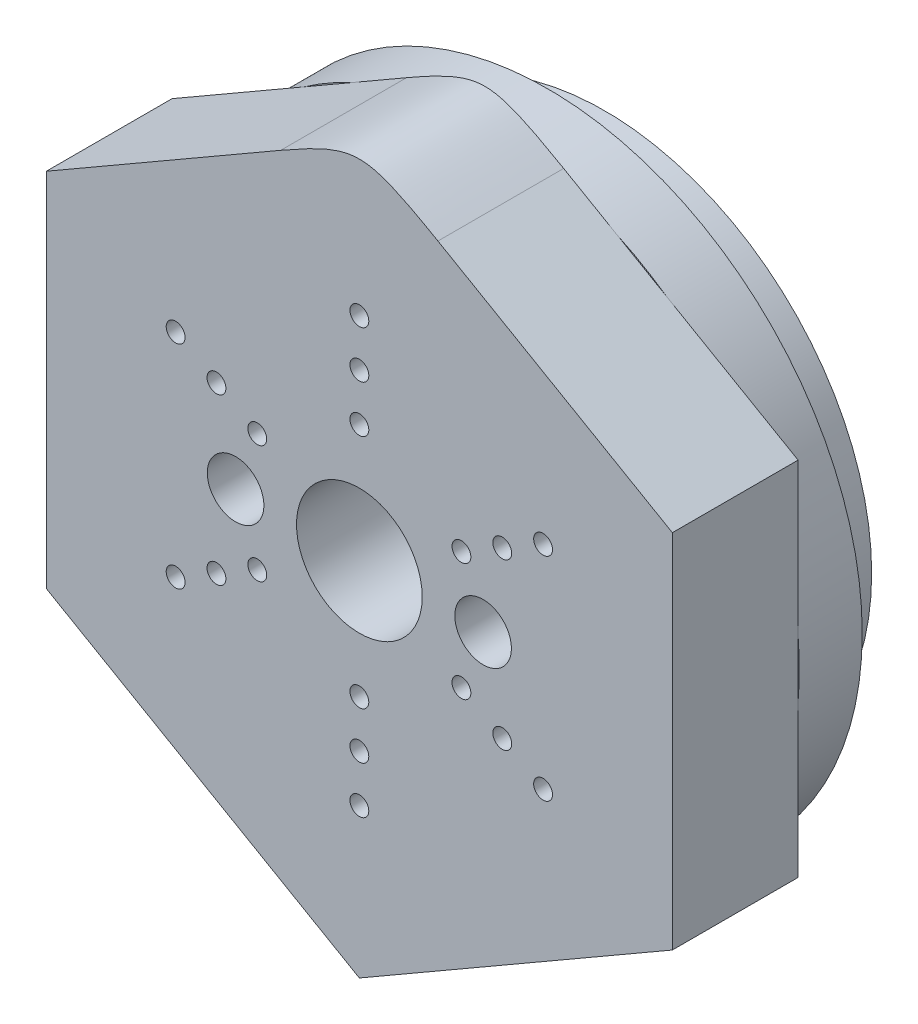
from build123d import *

# Parameters (mm, degrees)
SKETCH1_R               = 17
BOSS_EXTRUDE1_DEPTH     = 3.6
CAVITY1_OUTLINE_R       = 3.15
CAVITY1_DEPTH           = 3.283595969
CAVITY1_START           = 1.183595969
CAVITY1_2_OUTLINE_R     = 3.15
CAVITY1_2_OUTLINE_R_2   = 1.575
CAVITY1_2_DEPTH         = 2.1
SKETCH9_R               = 20
BOSS_EXTRUDE3_DEPTH     = 4
BOSS_EXTRUDE8_DEPTH     = 8
SKETCH2_R               = 0.6
CUT_EXTRUDE1_DEPTH      = 35.23974299
CIRPATTERN1_COUNT       = 6
SKETCH3_R               = 4.596048158
CUT_EXTRUDE2_DEPTH      = 3.283595969
CUT_EXTRUDE3_DEPTH      = 35.23974299
CUT_EXTRUDE3_DEPTH_BACK = 4
SKETCH4_R               = 4
SKETCH6_R               = 1.8
CUT_EXTRUDE4_DEPTH      = 35.23974299


with BuildPart() as part:
    # Sketch1 → Boss-Extrude1 (new body)
    with BuildSketch(Plane.XY):
        Circle(SKETCH1_R)
    extrude(amount=BOSS_EXTRUDE1_DEPTH)

    # Cavity1: read off the stored shape, not the designer's step
    # Cavity1 outline → Cavity1 (cut)
    with BuildSketch(Plane.XY):
        with BuildLine():
            Line((3.9375, 6.819950055), (2.048148228, 15.163776711))
            ThreePointArc((2.048148228, 15.163776711), (0, 16.8), (-2.048148228, 15.163776711))
            Line((-2.048148228, 15.163776711), (-3.9375, 6.819950055))
            Line((-3.9375, 6.819950055), (-12.108141735, 9.355636751))
            ThreePointArc((-12.108141735, 9.355636751), (-14.549226784, 8.4), (-14.156289963, 5.80813996))
            Line((-14.156289963, 5.80813996), (-7.875, 0))
            Line((-7.875, 0), (-14.156289963, -5.80813996))
            ThreePointArc((-14.156289963, -5.80813996), (-14.549226784, -8.4), (-12.108141735, -9.355636751))
            Line((-12.108141735, -9.355636751), (-3.9375, -6.819950055))
            Line((-3.9375, -6.819950055), (-2.048148228, -15.163776711))
            ThreePointArc((-2.048148228, -15.163776711), (0, -16.8), (2.048148228, -15.163776711))
            Line((2.048148228, -15.163776711), (3.9375, -6.819950055))
            Line((3.9375, -6.819950055), (12.108141735, -9.355636751))
            ThreePointArc((12.108141735, -9.355636751), (14.549226784, -8.4), (14.156289963, -5.80813996))
            Line((14.156289963, -5.80813996), (7.875, 0))
            Line((7.875, 0), (14.156289963, 5.80813996))
            ThreePointArc((14.156289963, 5.80813996), (14.549226784, 8.4), (12.108141735, 9.355636751))
            Line((12.108141735, 9.355636751), (3.9375, 6.819950055))
        make_face()
        Circle(CAVITY1_OUTLINE_R, mode=Mode.SUBTRACT)
    extrude(amount=CAVITY1_DEPTH, mode=Mode.SUBTRACT)

    # Cavity1 2 outline → Cavity1 2 (cut)
    with BuildSketch(Plane.XY.offset(CAVITY1_START)):
        Circle(CAVITY1_2_OUTLINE_R)
        Circle(CAVITY1_2_OUTLINE_R_2, mode=Mode.SUBTRACT)
    extrude(amount=CAVITY1_2_DEPTH, mode=Mode.SUBTRACT)

    # Sketch9 → Boss-Extrude3 (add)
    with BuildSketch(Plane.XY.offset(3.6)):
        Circle(SKETCH9_R)
    extrude(amount=BOSS_EXTRUDE3_DEPTH)

    # Sketch12 → Boss-Extrude8 (add)
    with BuildSketch(Plane.XY.offset(7.6)):
        Polygon((0, -23), (19.918584287, -11.5), (19.918584287, 11.5), (0, 23), (-19.918584287, 11.5), (-19.918584287, -11.5), align=None)
    extrude(amount=BOSS_EXTRUDE8_DEPTH)

    # Sketch2 → Cut-Extrude1 (cut, through all)
    with BuildSketch(Plane(origin=(0, 0, 0), x_dir=(-1, 0, 0), z_dir=(0, 0, -1))):
        with Locations((0, 13.5)):
            Circle(SKETCH2_R)
        with Locations((0, 10.5)):
            Circle(SKETCH2_R)
        with Locations((0, 7.5)):
            Circle(SKETCH2_R)
    cut_extrude1 = extrude(amount=-CUT_EXTRUDE1_DEPTH, mode=Mode.SUBTRACT)

    # CirPattern1: Cut-Extrude1 ×6 about axis
    cirpattern1_axis = Axis((0, 0, 0), (0, 0, 1))
    for i in range(1, CIRPATTERN1_COUNT):
        add(cut_extrude1.rotate(cirpattern1_axis, i * 360 / CIRPATTERN1_COUNT), mode=Mode.SUBTRACT)

    # Sketch3 → Cut-Extrude2 (cut)
    with BuildSketch(Plane(origin=(0, 0, 0), x_dir=(-1, 0, 0), z_dir=(0, 0, -1))):
        Circle(SKETCH3_R)
    extrude(amount=-CUT_EXTRUDE2_DEPTH, mode=Mode.SUBTRACT)

    # Sketch4 → Cut-Extrude3 (cut, two sides: drawn at the far end of the back side and taken through both)
    with BuildSketch(Plane.XY.offset(-CUT_EXTRUDE3_DEPTH_BACK)):
        Circle(SKETCH4_R)
    extrude(amount=CUT_EXTRUDE3_DEPTH + CUT_EXTRUDE3_DEPTH_BACK, mode=Mode.SUBTRACT)

    # Sketch6 → Cut-Extrude4 (cut, through all)
    with BuildSketch(Plane(origin=(0, 0, 0), x_dir=(-1, 0, 0), z_dir=(0, 0, -1))):
        with Locations((-7.875, 0)):
            Circle(SKETCH6_R)
        with Locations((7.875, 0)):
            Circle(SKETCH6_R)
    extrude(amount=-CUT_EXTRUDE4_DEPTH, mode=Mode.SUBTRACT)

    # Fillet1
    # a fillet whose section is not a circle: 10 mm, written as the material it takes off along each edge
    with BuildSketch(Plane(origin=(0, 23, -6.83375673), x_dir=(-0.8660254037844386, -0.5000000000000003, 0), z_dir=(0, 0, 1))) as fillet1_piece_1:
        with BuildLine():
            Bezier((5.773502692, 0), (0, 0), (-2.886751346, 5), weights=[1, 2.333333333, 1])
            Line((-2.886751346, 5), (0, 0))
            Line((0, 0), (5.773502692, 0))
        make_face()
    extrude(amount=36.867513459, mode=Mode.SUBTRACT)


solid = part.part
